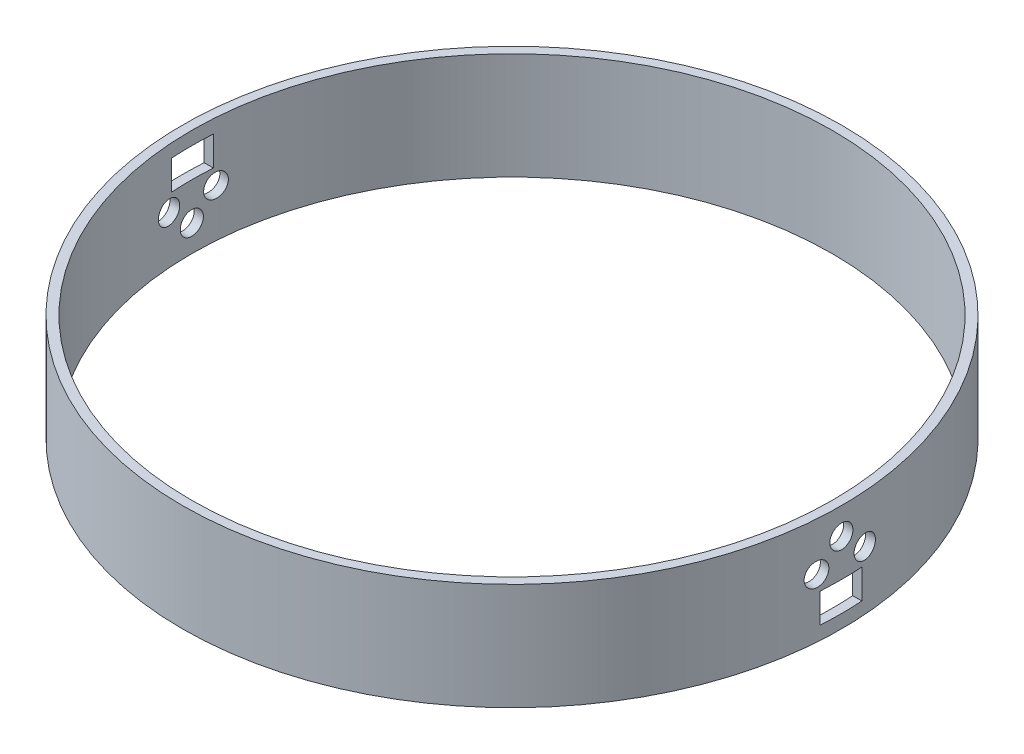
from build123d import *

# Parameters (mm, degrees)
SKETCH1_R           = 78.359
SKETCH1_R_2         = 76.1746
BOSS_EXTRUDE1_DEPTH = 25.4
SKETCH2_R           = 2.7499945
SKETCH2_W           = 10.000000066
SKETCH2_H           = 6.99999997
CUT_EXTRUDE1_DEPTH  = 114.690042493
SKETCH5_R           = 2.7499945
CUT_EXTRUDE2_DEPTH  = 114.690042653
CIRPATTERN1_COUNT   = 2
CIRPATTERN1_ANGLE   = 8.407249505
SKETCH8_R           = 2.7499945
SKETCH8_W           = 10.0000054
SKETCH8_H           = 7.0000114
CUT_EXTRUDE3_DEPTH  = 114.690042653
SKETCH9_R           = 2.7499945
CUT_EXTRUDE4_DEPTH  = 114.690042655
CIRPATTERN2_COUNT   = 2
CIRPATTERN2_ANGLE   = 8.41


with BuildPart() as part:
    # Sketch1 → Boss-Extrude1 (new body)
    with BuildSketch(Plane(origin=(0, 0, 0), x_dir=(1, 0, 0), z_dir=(0, 1, 0))):
        Circle(SKETCH1_R)
        Circle(SKETCH1_R_2, mode=Mode.SUBTRACT)
    extrude(amount=BOSS_EXTRUDE1_DEPTH)

    # Sketch2 → Cut-Extrude1 (cut, through all)
    with BuildSketch(Plane(origin=(0, 0, 0), x_dir=(0, 0, -1), z_dir=(1, 0, 0))):
        with Locations((0, 19.06499997)):
            Circle(SKETCH2_R)
        with Locations((0, 6.674999985)):
            Rectangle(SKETCH2_W, SKETCH2_H)
    extrude(amount=CUT_EXTRUDE1_DEPTH, mode=Mode.SUBTRACT)

    # Sketch5 → Cut-Extrude2 (cut, through all)
    with BuildSketch(Plane(origin=(0, 0, 0), x_dir=(0, -1, 0), z_dir=(0.9973452456045363, 0, 0.07281799962939917))):
        with Locations((-13.98499997, 0)):
            Circle(SKETCH5_R)
    cut_extrude2 = extrude(amount=CUT_EXTRUDE2_DEPTH, mode=Mode.SUBTRACT)

    # CirPattern1: Cut-Extrude2 ×2 about axis
    cirpattern1_axis = Axis((0, 25.4, 0), (0, 1, 0))
    for i in range(1, CIRPATTERN1_COUNT):
        add(cut_extrude2.rotate(cirpattern1_axis, i * CIRPATTERN1_ANGLE / (CIRPATTERN1_COUNT - 1)), mode=Mode.SUBTRACT)

    # Sketch8 → Cut-Extrude3 (cut, through all)
    with BuildSketch(Plane(origin=(0, 0, 0), x_dir=(0, 0, -1), z_dir=(1, 0, 0))):
        with Locations((0, 6.3349886)):
            Circle(SKETCH8_R)
        with Locations((0, 18.7249943)):
            Rectangle(SKETCH8_W, SKETCH8_H)
    extrude(amount=-CUT_EXTRUDE3_DEPTH, mode=Mode.SUBTRACT)

    # Sketch9 → Cut-Extrude4 (cut, through all)
    with BuildSketch(Plane(origin=(0, 0, 0), x_dir=(0, -1, 0), z_dir=(0.9973452456045363, 0, 0.07281799962939917))):
        with Locations((-11.4149886, 0)):
            Circle(SKETCH9_R)
    cut_extrude4 = extrude(amount=-CUT_EXTRUDE4_DEPTH, mode=Mode.SUBTRACT)

    # CirPattern2: Cut-Extrude4 ×2 about axis
    cirpattern2_axis = Axis((0, 25.4, 0), (0, 1, 0))
    for i in range(1, CIRPATTERN2_COUNT):
        add(cut_extrude4.rotate(cirpattern2_axis, i * CIRPATTERN2_ANGLE / (CIRPATTERN2_COUNT - 1)), mode=Mode.SUBTRACT)


solid = part.part
